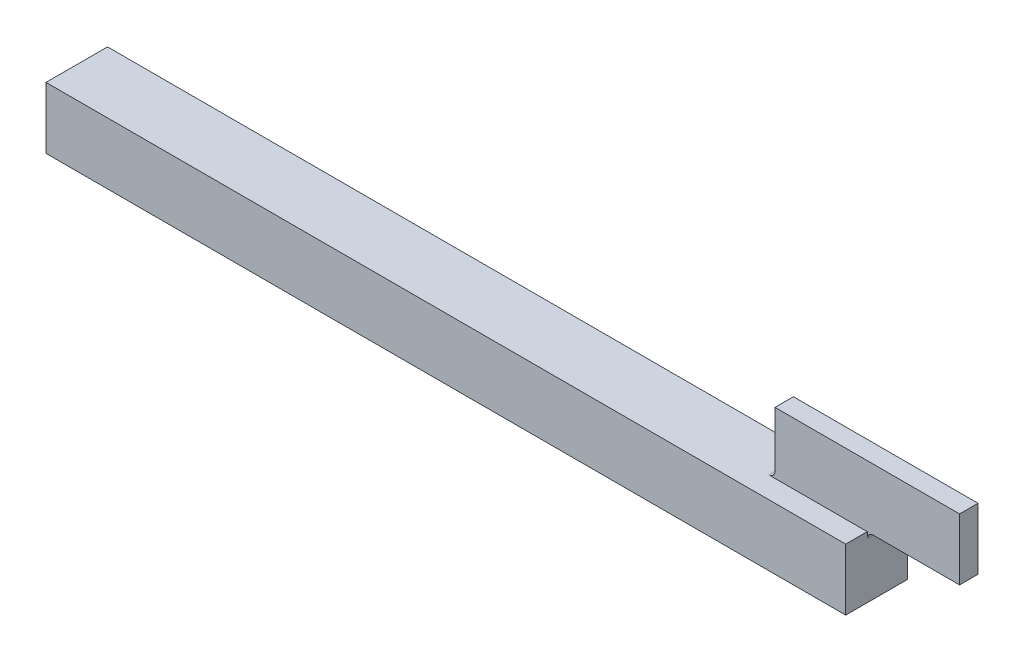
from build123d import *

# Parameters (mm, degrees)
ESQUISSE1_W        = 130
ESQUISSE1_H        = 10
BOSS_EXTRU_1_DEPTH = 10
ESQUISSE2_W        = 30
ESQUISSE2_H        = 3
BOSS_EXTRU_2_DEPTH = 10
CONG_1_R           = 1


with BuildPart() as part:
    # Esquisse1 → Boss.-Extru.1 (new body)
    with BuildSketch(Plane(origin=(0, 0, 0), x_dir=(1, 0, 0), z_dir=(0, 1, 0))):
        Rectangle(ESQUISSE1_W, ESQUISSE1_H)
    extrude(amount=BOSS_EXTRU_1_DEPTH)

    # Esquisse2 → Boss.-Extru.2 (add)
    with BuildSketch(Plane(origin=(0, 10, 0), x_dir=(1, 0, 0), z_dir=(0, 1, 0))):
        with Locations((65, 0)):
            Rectangle(ESQUISSE2_W, ESQUISSE2_H)
    extrude(amount=BOSS_EXTRU_2_DEPTH)

    # Congé1
    cong_1_edges = [part.edges().sort_by_distance(p)[0] for p in [
        (50, 10, 0),
        (65, 10, 0),
    ]]
    fillet(cong_1_edges, radius=CONG_1_R)


solid = part.part
